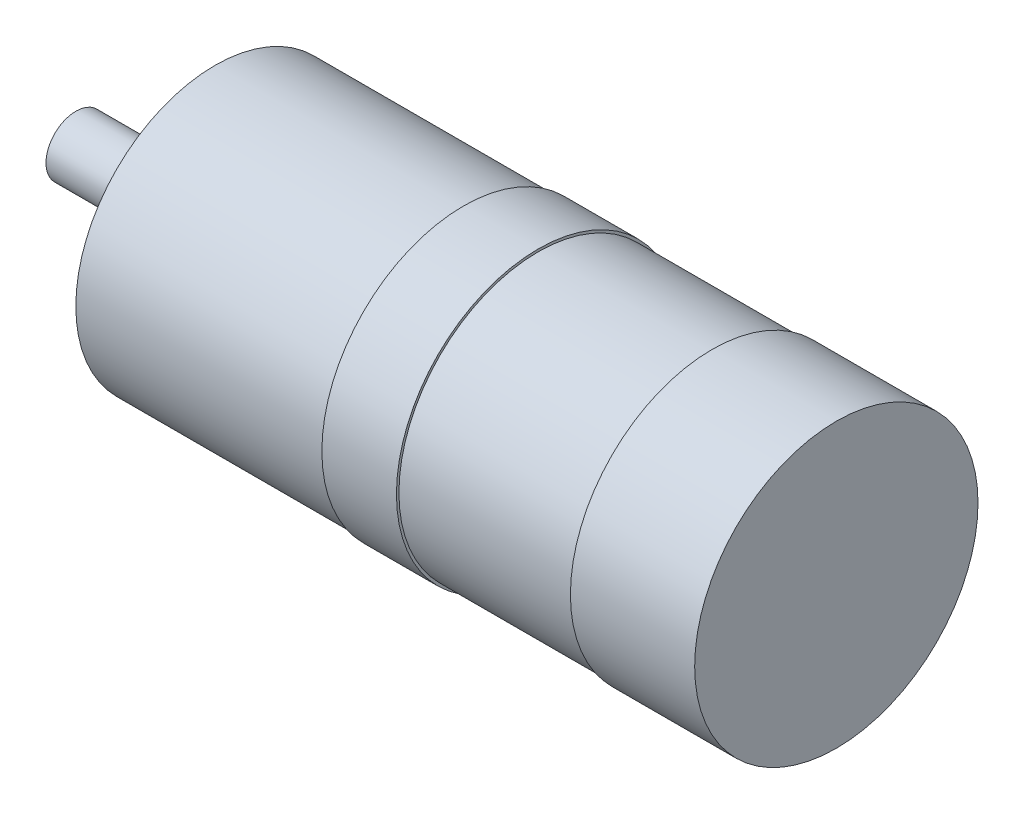
from build123d import *

# Parameters (mm, degrees)
SKETCH2_R          = 2.1
CUT_EXTRUDE1_DEPTH = 6.5


with BuildPart() as part:
    # Sketch1 → Revolve1 (revolve)
    with BuildSketch(Plane.XY):
        Polygon((0, 0), (153, 0), (153, 28.5), (128, 28.5), (128, 28), (93, 28), (93, 28.5), (78, 28.5), (78, 28), (28, 28), (28, 16), (26, 16), (26, 6), (0, 6), align=None)
    revolve(axis=Axis((-903.237381769, 0, 0), (1, 0, 0)))

    # Sketch2 → Cut-Extrude1 (cut)
    with BuildSketch(Plane.ZY.offset(-28)):
        with Locations((-15.909902577, 15.909902577)):
            Circle(SKETCH2_R)
        with Locations((15.909902577, 15.909902577)):
            Circle(SKETCH2_R)
        with Locations((15.909902577, -15.909902577)):
            Circle(SKETCH2_R)
        with Locations((-15.909902577, -15.909902577)):
            Circle(SKETCH2_R)
    extrude(amount=-CUT_EXTRUDE1_DEPTH, mode=Mode.SUBTRACT)


solid = part.part
